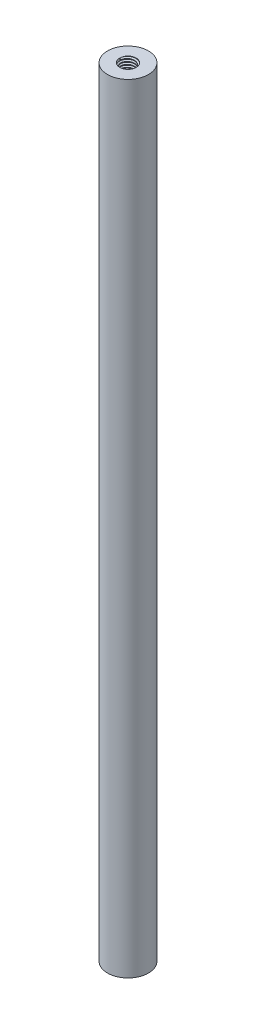
from build123d import *

# Parameters (mm, degrees)
SKETCH1_R           = 10
BOSS_EXTRUDE1_DEPTH = 190
THREAD1_PITCH       = 1.25
THREAD2_PITCH       = 1.25


with BuildPart() as part:
    # Sketch1 → Boss-Extrude1 (new body)
    with BuildSketch(Plane(origin=(0, 0, 0), x_dir=(1, 0, 0), z_dir=(0, 1, 0))):
        with Locations(Location((0, 0, 0), (0, 0, 270))):
            Circle(SKETCH1_R)
    boss_extrude1 = extrude(amount=BOSS_EXTRUDE1_DEPTH)

    # Sketch4 → Ø8.0mm Dowel Hole1 (revolve, cut)
    with BuildSketch(Plane(origin=(0, 190, 0), x_dir=(0, 0, 1), z_dir=(1, 0, 0))):
        Polygon((0, 0), (0, 22.403442476), (4, 20), (4, 0), align=None)
    f_8_0mm_dowel_hole1 = revolve(axis=Axis((0, 196.35, 0), (0, -1, 0)), mode=Mode.SUBTRACT)

    # Thread1: the profile of Thread Profile1 profile screwed along a right-hand helix of 16 turns, 8 arcs to a turn; built about Z, then put on its axis
    thread1_z = Axis((0, 0, 0), (0, 0, 1))
    thread1_corners = [(4.0003, 0, -0.000173205), (4.0003, 0, 1.093923202), (3.323417656, 0, 0.703124998), (3.323417656, 0, 0.390624998)]
    with BuildLine(mode=Mode.PRIVATE) as thread1_profile:
        Line(thread1_corners[0], thread1_corners[1])
        Line(thread1_corners[1], thread1_corners[2])
        Line(thread1_corners[2], thread1_corners[3])
        Line(thread1_corners[3], thread1_corners[0])
    thread1_cap = Face(thread1_profile.wire())
    thread1_turn_angles = [0, 22.5, 45, 67.5, 90, 112.5, 135, 157.5, 180, 202.5, 225, 247.5, 270, 292.5, 315, 337.5, 360]
    thread1_turn_weights = [1, 0.9238795325112867, 1, 0.9238795325112867, 1, 0.9238795325112867, 1, 0.9238795325112867, 1, 0.9238795325112867, 1, 0.9238795325112867, 1, 0.9238795325112867, 1, 0.9238795325112867, 1]
    thread1_turn_rails = [Edge.make_bspline([Vector(p[0], p[1], 0).rotate(thread1_z, thread1_turn_angles[k]) / thread1_turn_weights[k] + Vector(0, 0, p[2] + THREAD1_PITCH * thread1_turn_angles[k] / 360) for k in range(17)], [0, 0, 0, 1, 1, 2, 2, 3, 3, 4, 4, 5, 5, 6, 6, 7, 7, 8, 8, 8], 2, thread1_turn_weights) for p in thread1_corners]
    thread1_turn_sides = [Face.make_surface_from_curves(thread1_turn_rails[p[0]], thread1_turn_rails[p[1]]) for p in [(0, 1), (1, 2), (2, 3), (3, 0)]]
    thread1 = Plane(origin=(0, 190, 0), x_dir=(-1, 0, 0), z_dir=(0, -1, 0)) * Solid(Shell([*[p.moved(Location((0, 0, THREAD1_PITCH * i))) for i in range(16) for p in thread1_turn_sides], thread1_cap, thread1_cap.rotate(thread1_z, 5760).moved(Location((0, 0, THREAD1_PITCH * 5760 / 360)))]))
    add(thread1)

    # Mirror2: Boss-Extrude1, Ø8.0mm Dowel Hole1 across plane
    add(boss_extrude1.mirror(Plane.ZX))
    add(f_8_0mm_dowel_hole1.mirror(Plane.ZX), mode=Mode.SUBTRACT)

    # Thread2: the profile of Thread Profile2 profile screwed along a right-hand helix of 16 turns, 8 arcs to a turn; built about Z, then put on its axis
    thread2_z = Axis((0, 0, 0), (0, 0, 1))
    thread2_corners = [(4.0003, 0, -0.000173205), (4.0003, 0, 1.093923202), (3.323417656, 0, 0.703124998), (3.323417656, 0, 0.390624998)]
    with BuildLine(mode=Mode.PRIVATE) as thread2_profile:
        Line(thread2_corners[0], thread2_corners[1])
        Line(thread2_corners[1], thread2_corners[2])
        Line(thread2_corners[2], thread2_corners[3])
        Line(thread2_corners[3], thread2_corners[0])
    thread2_cap = Face(thread2_profile.wire())
    thread2_turn_angles = [0, 22.5, 45, 67.5, 90, 112.5, 135, 157.5, 180, 202.5, 225, 247.5, 270, 292.5, 315, 337.5, 360]
    thread2_turn_weights = [1, 0.9238795325112867, 1, 0.9238795325112867, 1, 0.9238795325112867, 1, 0.9238795325112867, 1, 0.9238795325112867, 1, 0.9238795325112867, 1, 0.9238795325112867, 1, 0.9238795325112867, 1]
    thread2_turn_rails = [Edge.make_bspline([Vector(p[0], p[1], 0).rotate(thread2_z, thread2_turn_angles[k]) / thread2_turn_weights[k] + Vector(0, 0, p[2] + THREAD2_PITCH * thread2_turn_angles[k] / 360) for k in range(17)], [0, 0, 0, 1, 1, 2, 2, 3, 3, 4, 4, 5, 5, 6, 6, 7, 7, 8, 8, 8], 2, thread2_turn_weights) for p in thread2_corners]
    thread2_turn_sides = [Face.make_surface_from_curves(thread2_turn_rails[p[0]], thread2_turn_rails[p[1]]) for p in [(0, 1), (1, 2), (2, 3), (3, 0)]]
    thread2 = Plane(origin=(0, -190, 0), x_dir=(1, 0, 0), z_dir=(0, 1, 0)) * Solid(Shell([*[p.moved(Location((0, 0, THREAD2_PITCH * i))) for i in range(16) for p in thread2_turn_sides], thread2_cap, thread2_cap.rotate(thread2_z, 5760).moved(Location((0, 0, THREAD2_PITCH * 5760 / 360)))]))
    add(thread2)


solid = part.part
